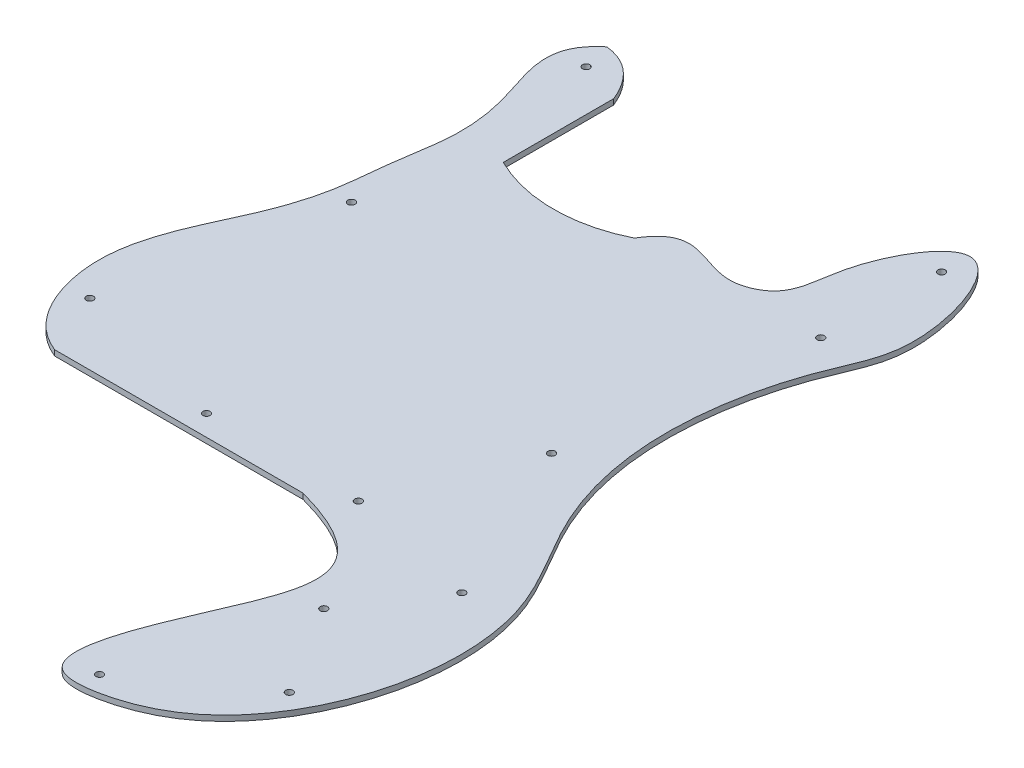
from build123d import *

# Parameters (mm, degrees)
SKETCH1_R           = 1.6764
BOSS_EXTRUDE1_DEPTH = 2.54


with BuildPart() as part:
    # Sketch1 → Boss-Extrude1 (new body)
    with BuildSketch(Plane(origin=(0, 0, 0), x_dir=(1, 0, 0), z_dir=(0, 1, 0))):
        with BuildLine():
            add(Edge.make_bspline(
                [(0, 0), (-11.530009109, 4.514458613), (-23.598116483, 21.764864338), (-27.141921833, 51.196086815), (-19.613077512, 77.06977201), (-7.49782478, 100.945161618), (1.098739727, 126.482448194), (2.538563392, 152.451362426), (7.778248397, 177.773773965), (3.499596198, 210.514145227), (-10.048019094, 234.324881398), (6.35, 247.65)],
                knots=[0, 0, 0, 0, 0.130338526, 0.226963598, 0.325793327, 0.430446663, 0.530898137, 0.627523208, 0.72414828, 0.820773351, 1, 1, 1, 1], degree=3))
            Line((0, 0), (114.3, 0))
            add(Edge.make_bspline(
                [(114.3, 0), (170.623192114, -15.324499827), (142.778538688, -51.014826152), (117.072370085, -130.865354033), (166.910373227, -124.747305796), (211.270043304, -85.648094536), (223.254152949, -5.84316241), (185.826230854, 45.08468032), (168.892743993, 100.701866142), (177.456556308, 154.68299123), (201.016482927, 201.558360826), (177.939980571, 271.837359168), (147.118130497, 218.1362838), (148.128075893, 189.829801963), (118.716390008, 176.497868685), (100.979559676, 198.210582651), (88.9, 177.8)],
                knots=[0, 0, 0, 0, 0.148092664, 0.210362687, 0.240168738, 0.321979976, 0.461111394, 0.528032739, 0.586689278, 0.706181911, 0.74268238, 0.823050716, 0.881913078, 0.917688905, 0.939312918, 1, 1, 1, 1], degree=3))
            ThreePointArc((88.9, 177.8), (58.7375, 170.688), (28.575, 177.8))
            Line((28.575, 177.8), (28.575, 228.6))
            add(Edge.make_bspline(
                [(6.35, 247.65), (21.424126315, 246.030027347), (28.575, 228.6)],
                knots=[0, 0, 0, 1, 1, 1], degree=2))
        make_face()
        with Locations((-12.3825, 28.575)):
            Circle(SKETCH1_R, mode=Mode.SUBTRACT)
        with Locations((60.325, 9.525)):
            Circle(SKETCH1_R, mode=Mode.SUBTRACT)
        with Locations((139.7, -119.0625)):
            Circle(SKETCH1_R, mode=Mode.SUBTRACT)
        with Locations((190.5, -82.55)):
            Circle(SKETCH1_R, mode=Mode.SUBTRACT)
        with Locations((165.1, -41.275)):
            Circle(SKETCH1_R, mode=Mode.SUBTRACT)
        with Locations((130.175, 9.525)):
            Circle(SKETCH1_R, mode=Mode.SUBTRACT)
        with Locations((190.5, -3.175)):
            Circle(SKETCH1_R, mode=Mode.SUBTRACT)
        with Locations((9.525, 127)):
            Circle(SKETCH1_R, mode=Mode.SUBTRACT)
        with Locations((9.525, 234.95)):
            Circle(SKETCH1_R, mode=Mode.SUBTRACT)
        with Locations((155.575, 73.025)):
            Circle(SKETCH1_R, mode=Mode.SUBTRACT)
        with Locations((171.45, 180.975)):
            Circle(SKETCH1_R, mode=Mode.SUBTRACT)
        with Locations((173.0375, 234.95)):
            Circle(SKETCH1_R, mode=Mode.SUBTRACT)
    extrude(amount=BOSS_EXTRUDE1_DEPTH)


solid = part.part
